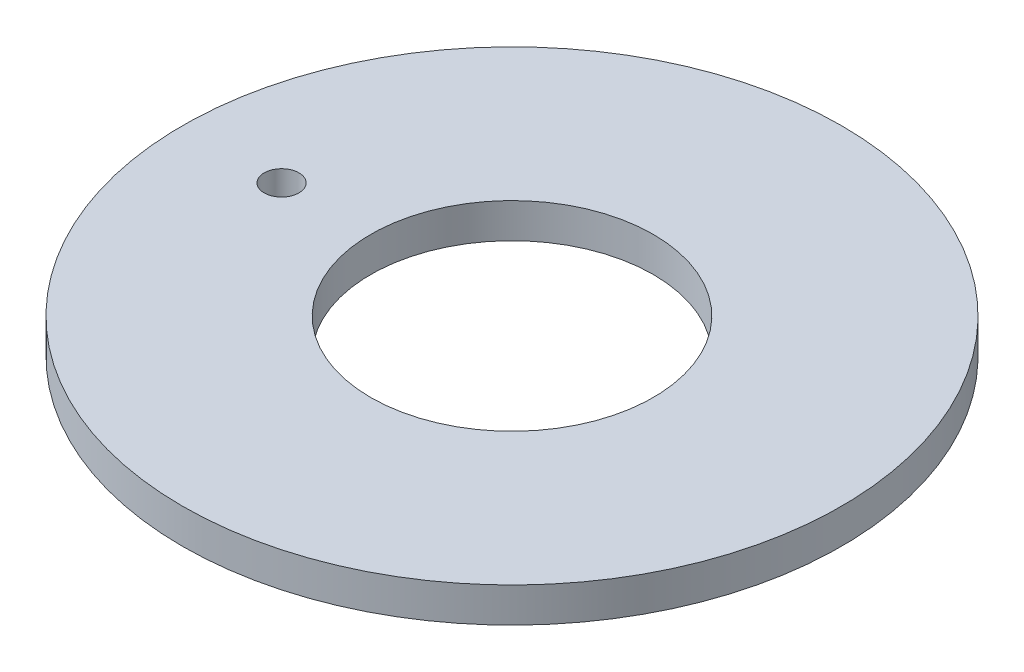
from build123d import *

# Parameters (mm, degrees)
SKETCH1_R           = 37.9
SKETCH1_R_2         = 16.25
BOSS_EXTRUDE1_DEPTH = 4
SKETCH2_R           = 2
CUT_EXTRUDE1_DEPTH  = 54.747744139


with BuildPart() as part:
    # Sketch1 → Boss-Extrude1 (new body)
    with BuildSketch(Plane(origin=(0, 0, 0), x_dir=(1, 0, 0), z_dir=(0, 1, 0))):
        Circle(SKETCH1_R)
        Circle(SKETCH1_R_2, mode=Mode.SUBTRACT)
    extrude(amount=BOSS_EXTRUDE1_DEPTH)

    # Sketch2 → Cut-Extrude1 (cut, through all)
    with BuildSketch(Plane(origin=(0, 4, 0), x_dir=(1, 0, 0), z_dir=(0, 1, 0))):
        with Locations((-26.5, 0)):
            Circle(SKETCH2_R)
    extrude(amount=-CUT_EXTRUDE1_DEPTH, mode=Mode.SUBTRACT)


solid = part.part
